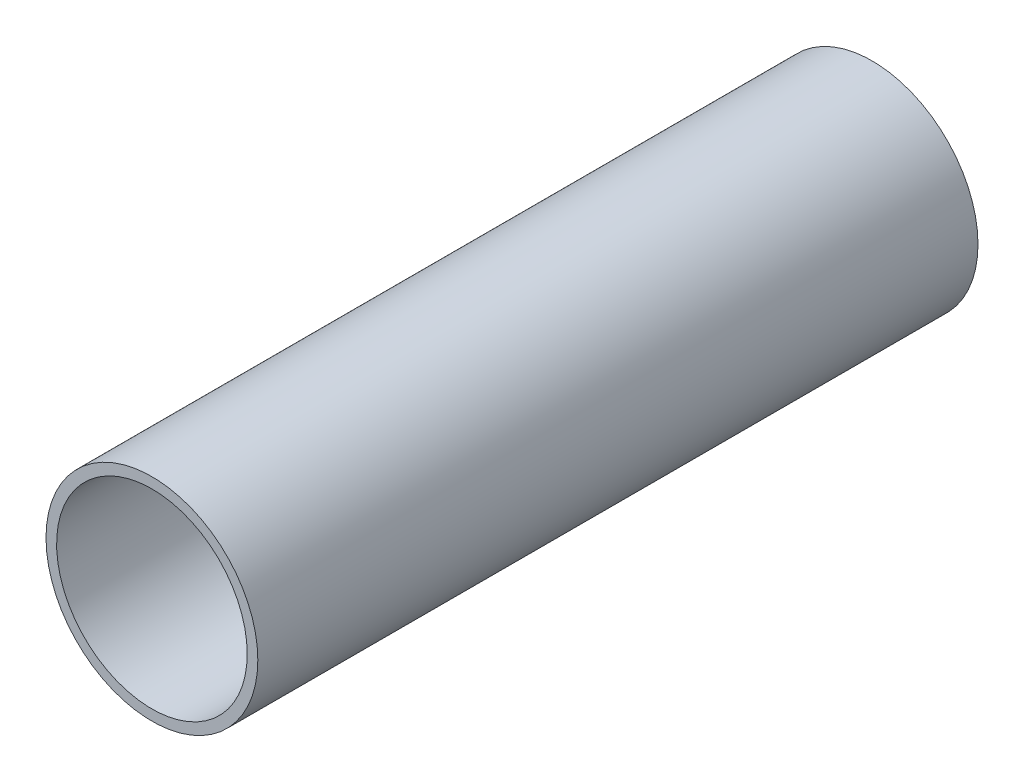
from build123d import *

# Parameters (mm, degrees)
SKETCH2_R           = 7.5
SKETCH2_R_2         = 6.75
BOSS_EXTRUDE2_DEPTH = 50
BOSS_EXTRUDE4_START = 1
SKETCH5_R           = 7.5
BOSS_EXTRUDE4_DEPTH = 1


with BuildPart() as part:
    # Sketch2 → Boss-Extrude2 (new body)
    with BuildSketch(Plane.XY):
        Circle(SKETCH2_R)
        Circle(SKETCH2_R_2, mode=Mode.SUBTRACT)
    extrude(amount=BOSS_EXTRUDE2_DEPTH)

    # Sketch5 → Boss-Extrude4 (add)
    with BuildSketch(Plane(origin=(0, 0, 0), x_dir=(-1, 0, 0), z_dir=(0, 0, -1)).offset(BOSS_EXTRUDE4_START)):
        Circle(SKETCH5_R)
        with BuildLine():
            ThreePointArc((0.997252742, -6.675925926), (0, -5.75), (-0.997252742, -6.675925926))
            ThreePointArc((-0.997252742, -6.675925926), (-6.75, 0), (-0.997252742, 6.675925926))
            ThreePointArc((-0.997252742, 6.675925926), (0, 5.75), (0.997252742, 6.675925926))
            ThreePointArc((0.997252742, 6.675925926), (6.75, 0), (0.997252742, -6.675925926))
        make_face(mode=Mode.SUBTRACT)
    extrude(amount=-BOSS_EXTRUDE4_DEPTH)


solid = part.part
